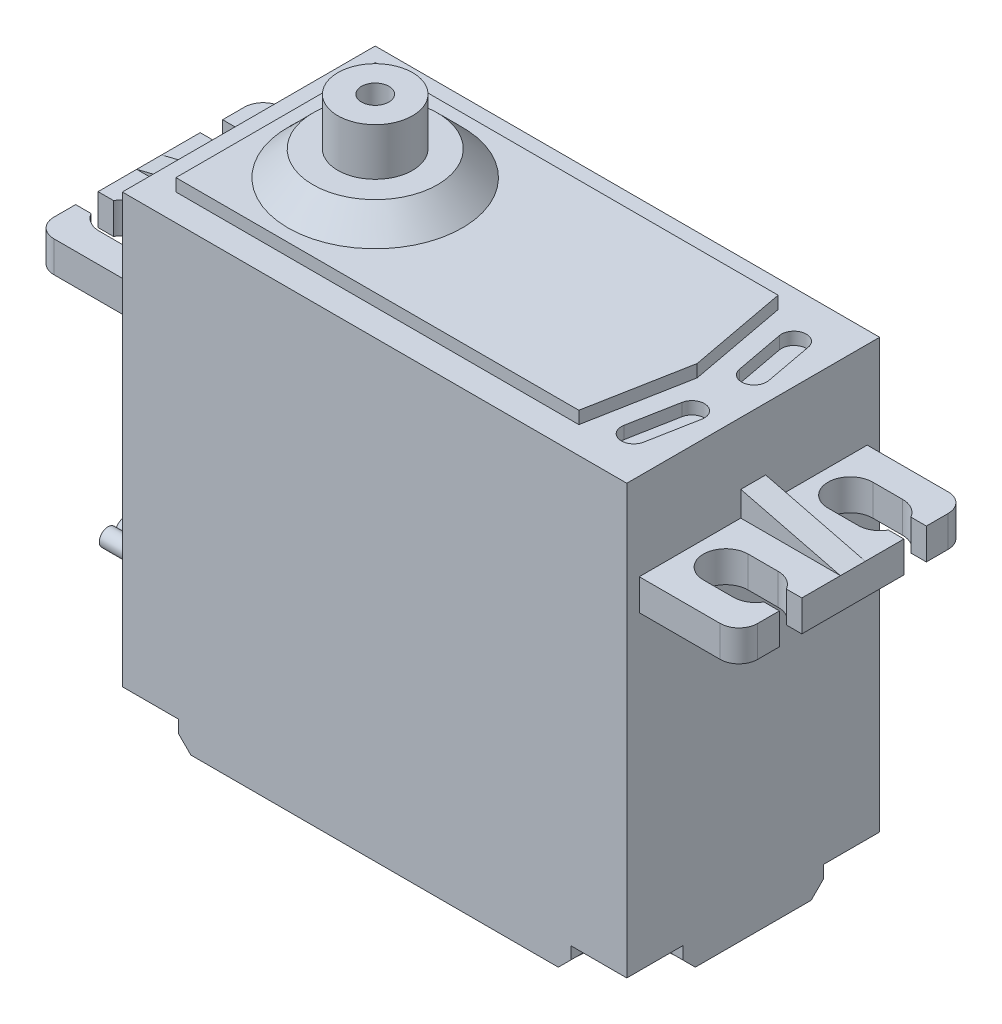
from build123d import *

# Parameters (mm, degrees)
SKETCH1_W                = 40.5
SKETCH1_H                = 20.3
BOSS_EXTRUDE1_DEPTH      = 37.4
SKETCH2_R                = 7
BOSS_EXTRUDE2_DEPTH      = 2
CHAMFER1_SIZE            = 2
SKETCH3_R                = 3
SKETCH3_R_2              = 1.1
BOSS_EXTRUDE3_DEPTH      = 3.8
SKETCH4_W                = 8
SKETCH4_H                = 18.3
BOSS_EXTRUDE4_DEPTH      = 2.5
CUT_EXTRUDE1_DEPTH       = 43.01719886
BOSS_EXTRUDE5_DEPTH      = 1
MIRROR3_COPY_1_DEPTH     = 43.01719886
FILLET2_R                = 1.5
SKETCH7_W                = 7.5
SKETCH7_H                = 4
BOSS_EXTRUDE6_DEPTH      = 5
BOSS_EXTRUDE7_DEPTH      = 5
DRAFT1_ANGLE             = 5
FILLET3_R                = 1.5
CUT_EXTRUDE2_DEPTH       = 2
CHAMFER2_SIZE            = 1
CHAMFER2_OF_MIRROR4_SIZE = 1
MIRROR5_START            = 18.75
MIRROR5_3_DEPTH          = 2.25
MIRROR5_START_2          = -11
MIRROR5_4_DEPTH          = 2.35
MIRROR5_START_3          = 8.65
MIRROR5_5_DEPTH          = 2.35
SKETCH10_W               = 40.5
SKETCH10_H               = 20.3
CUT_EXTRUDE3_DEPTH       = 1
CUT_EXTRUDE4_DEPTH       = 1


with BuildPart() as part:
    # Sketch1 → Boss-Extrude1 (new body)
    with BuildSketch(Plane(origin=(0, 0, 0), x_dir=(1, 0, 0), z_dir=(0, 1, 0))):
        Rectangle(SKETCH1_W, SKETCH1_H)
    extrude(amount=BOSS_EXTRUDE1_DEPTH)

    # Sketch2 → Boss-Extrude2 (add)
    with BuildSketch(Plane(origin=(0, 37.4, 0), x_dir=(1, 0, 0), z_dir=(0, 1, 0))):
        with Locations(Location((-10.1, 0, 0), (0, 0, 270))):
            Circle(SKETCH2_R)
    extrude(amount=BOSS_EXTRUDE2_DEPTH)

    # Chamfer1
    chamfer1_edges = [part.edges().sort_by_distance(p)[0] for p in [
        (-10.1, 39.4, -7),
    ]]
    chamfer(chamfer1_edges, length=CHAMFER1_SIZE - 0.0001)  # a hair under: the kernel refuses the full size

    # Sketch3 → Boss-Extrude3 (add)
    with BuildSketch(Plane(origin=(0, 39.4, 0), x_dir=(1, 0, 0), z_dir=(0, 1, 0))):
        with Locations(Location((-10.1, 0, 0), (0, 0, 90))):
            Circle(SKETCH3_R)
        with Locations(Location((-10.1, 0, 0), (0, 0, 90))):
            Circle(SKETCH3_R_2, mode=Mode.SUBTRACT)
    extrude(amount=BOSS_EXTRUDE3_DEPTH)

    # Sketch4 → Boss-Extrude4 (add)
    with BuildSketch(Plane(origin=(0, 29.4, 0), x_dir=(1, 0, 0), z_dir=(0, 1, 0))):
        with Locations((-24.25, 0)):
            Rectangle(SKETCH4_W, SKETCH4_H)
    boss_extrude4 = extrude(amount=-BOSS_EXTRUDE4_DEPTH)

    # Sketch5 → Cut-Extrude1 (cut, through all)
    with BuildSketch(Plane(origin=(0, 29.4, 0), x_dir=(1, 0, 0), z_dir=(0, 1, 0))):
        with BuildLine():
            Line((-25.45, -3.2), (-23.05, -3.2))
            ThreePointArc((-23.05, -3.2), (-21.25, -5), (-23.05, -6.8))
            Line((-23.05, -6.8), (-25.45, -6.8))
            ThreePointArc((-25.45, -6.8), (-26.35, -6.558845727), (-27.008845727, -5.9))
            Line((-27.008845727, -5.9), (-28.25, -5.9))
            Line((-28.25, -5.9), (-28.25, -4.1))
            Line((-28.25, -4.1), (-27.008845727, -4.1))
            ThreePointArc((-27.008845727, -4.1), (-26.35, -3.441154273), (-25.45, -3.2))
        make_face()
    cut_extrude1 = extrude(amount=-CUT_EXTRUDE1_DEPTH, mode=Mode.SUBTRACT)

    # Mirror2: Cut-Extrude1 across plane
    add(cut_extrude1.mirror(Plane.XY), mode=Mode.SUBTRACT)

    # Sketch6 → Boss-Extrude5 (add, symmetric)
    with BuildSketch(Plane.XY):
        Polygon((-28.25, 29.4), (-20.25, 29.4), (-20.25, 31.4), align=None)
    boss_extrude5 = extrude(amount=BOSS_EXTRUDE5_DEPTH, both=True)

    # Mirror3: Boss-Extrude4, Cut-Extrude1, Boss-Extrude5 across plane
    add(boss_extrude4.mirror(Plane(origin=(0, 0, 0), x_dir=(0, 0, 1), z_dir=(1, 0, 0))))
    add(cut_extrude1.mirror(Plane(origin=(0, 0, 0), x_dir=(0, 0, 1), z_dir=(1, 0, 0))), mode=Mode.SUBTRACT)
    add(boss_extrude5.mirror(Plane(origin=(0, 0, 0), x_dir=(0, 0, 1), z_dir=(1, 0, 0))))

    # Mirror3 copy 1 sketch → Mirror3 copy 1 (cut, through all)
    with BuildSketch(Plane(origin=(0, 29.4, 0), x_dir=(-1, 0, 0), z_dir=(0, 1, 0))):
        with BuildLine():
            Line((-25.45, -3.2), (-23.05, -3.2))
            ThreePointArc((-23.05, -3.2), (-21.25, -5), (-23.05, -6.8))
            Line((-23.05, -6.8), (-25.45, -6.8))
            ThreePointArc((-25.45, -6.8), (-26.35, -6.558845727), (-27.008845727, -5.9))
            Line((-27.008845727, -5.9), (-28.25, -5.9))
            Line((-28.25, -5.9), (-28.25, -4.1))
            Line((-28.25, -4.1), (-27.008845727, -4.1))
            ThreePointArc((-27.008845727, -4.1), (-26.35, -3.441154273), (-25.45, -3.2))
        make_face()
    extrude(amount=-MIRROR3_COPY_1_DEPTH, mode=Mode.SUBTRACT)

    # Fillet2
    fillet2_edges = [part.edges().sort_by_distance(p)[0] for p in [
        (28.25, 28.15, -9.15),
        (28.25, 28.15, 9.15),
        (-28.25, 28.15, 9.15),
        (-28.25, 28.15, -9.15),
    ]]
    fillet(fillet2_edges, radius=FILLET2_R)

    # Sketch7 → Boss-Extrude6 (add)
    with BuildSketch(Plane.ZY.offset(20.25)):
        with Locations((0, 3)):
            Rectangle(SKETCH7_W, SKETCH7_H)
    extrude(amount=BOSS_EXTRUDE6_DEPTH)

    # Sketch8 → Boss-Extrude7 (add)
    with BuildSketch(Plane.ZY.offset(25.25)):
        with BuildLine():
            ThreePointArc((-0.65, 3.259807621), (-2, 3), (-0.65, 2.740192379))
            ThreePointArc((-0.65, 2.740192379), (0, 2.3), (0.65, 2.740192379))
            ThreePointArc((0.65, 2.740192379), (2, 3), (0.65, 3.259807621))
            ThreePointArc((0.65, 3.259807621), (0, 3.7), (-0.65, 3.259807621))
        make_face()
    extrude(amount=BOSS_EXTRUDE7_DEPTH)

    # Draft1
    draft1_faces = [part.faces().sort_by_distance(p)[0] for p in [
        (-22.75, 1, 0),
        (-22.75, 3, -3.75),
        (-22.75, 3, 3.75),
        (-22.75, 5, 0),
    ]]
    draft(draft1_faces, Plane(origin=(-20.25, 37.4, -10.15), x_dir=(0, 0, -1), z_dir=(-1, 0, 0)), DRAFT1_ANGLE)

    # Fillet3
    fillet3_edges = [part.edges().sort_by_distance(p)[0] for p in [
        (-22.75, 4.781278341, -3.531278341),
        (-22.75, 1.218721659, -3.531278341),
        (-22.75, 1.218721659, 3.531278341),
        (-22.75, 4.781278341, 3.531278341),
    ]]
    fillet(fillet3_edges, radius=FILLET3_R)

    # Sketch9 → Cut-Extrude2 (cut)
    with BuildSketch(Plane.XZ):
        with BuildLine():
            Line((-20.25, 10.15), (-20.25, 5.65))
            Line((-20.25, 5.65), (-18.75, 5.65))
            ThreePointArc((-18.75, 5.65), (-16.628679656, 6.528679656), (-15.75, 8.65))
            Line((-15.75, 8.65), (-15.75, 10.15))
            Line((-15.75, 10.15), (-20.25, 10.15))
        make_face()
    cut_extrude2 = extrude(amount=-CUT_EXTRUDE2_DEPTH, mode=Mode.SUBTRACT)

    # Chamfer2
    chamfer2_edges = [part.edges().sort_by_distance(p)[0] for p in [
        (-19.5, 0, 5.65),
        (-16.628679656, 0, 6.528679656),
        (-15.75, 0, 9.4),
    ]]
    chamfer(chamfer2_edges, length=CHAMFER2_SIZE)

    # Mirror4: Cut-Extrude2 across plane
    add(cut_extrude2.mirror(Plane.XY), mode=Mode.SUBTRACT)

    # Chamfer2 of Mirror4
    chamfer2_of_mirror4_edges = [part.edges().sort_by_distance(p)[0] for p in [
        (-19.5, 0, -5.65),
        (-16.628679656, 0, -6.528679656),
        (-15.75, 0, -9.4),
    ]]
    chamfer(chamfer2_of_mirror4_edges, length=CHAMFER2_OF_MIRROR4_SIZE)

    # Mirror5: read off the stored shape, not the designer's step
    # Mirror5 outline → Mirror5 (revolve, cut)
    with BuildSketch(Plane(origin=(18.75, 0, -8.65), x_dir=(1, 0, 0), z_dir=(0, 0, 1))):
        Polygon((3, 1), (3, 2), (0, 2), (0, 0), (4, 0), align=None)
    revolve(axis=Axis((18.75, 0, -8.65), (0, 1, 0)), mode=Mode.SUBTRACT)

    # Mirror5 2 outline → Mirror5 2 (revolve, cut)
    with BuildSketch(Plane(origin=(18.75, 0, 8.65), x_dir=(1, 0, 0), z_dir=(0, 0, 1))):
        Polygon((3, 1), (3, 2), (0, 2), (0, 0), (4, 0), align=None)
    revolve(axis=Axis((18.75, 0, 8.65), (0, 1, 0)), mode=Mode.SUBTRACT)

    # Mirror5 3 outline → Mirror5 3 (cut)
    with BuildSketch(Plane.YZ.offset(MIRROR5_START)):
        Polygon((1, -5.65), (0, -4.65), (0, -10.15), (2, -10.15), (2, -5.65), align=None)
        Polygon((1, 5.65), (2, 5.65), (2, 10.15), (0, 10.15), (0, 4.65), align=None)
    extrude(amount=MIRROR5_3_DEPTH, mode=Mode.SUBTRACT)

    # Mirror5 4 outline → Mirror5 4 (cut)
    with BuildSketch(Plane.XY.offset(MIRROR5_START_2)):
        Polygon((15.75, 2), (15.75, 1), (14.75, 0), (20.25, 0), (20.25, 2), align=None)
    extrude(amount=MIRROR5_4_DEPTH, mode=Mode.SUBTRACT)

    # Mirror5 5 outline → Mirror5 5 (cut)
    with BuildSketch(Plane.XY.offset(MIRROR5_START_3)):
        Polygon((15.75, 2), (15.75, 1), (14.75, 0), (20.25, 0), (20.25, 2), align=None)
    extrude(amount=MIRROR5_5_DEPTH, mode=Mode.SUBTRACT)

    # Sketch10 → Cut-Extrude3 (cut)
    with BuildSketch(Plane(origin=(0, 37.4, 0), x_dir=(1, 0, 0), z_dir=(0, 1, 0))):
        Rectangle(SKETCH10_W, SKETCH10_H)
        Polygon((-18.1, -8), (14.25, -8), (15.75, 0), (14.25, 8), (-18.1, 8), align=None, mode=Mode.SUBTRACT)
    extrude(amount=-CUT_EXTRUDE3_DEPTH, mode=Mode.SUBTRACT)

    # Sketch11 → Cut-Extrude4 (cut)
    with BuildSketch(Plane(origin=(0, 36.4, 0), x_dir=(1, 0, 0), z_dir=(0, 1, 0))):
        with BuildLine():
            Line((16.842885351, 2.310688429), (16.10573121, 6.242177176))
            ThreePointArc((16.10573121, 6.242177176), (16.904314862, 7.409337898), (18.071475584, 6.610754247))
            Line((18.071475584, 6.610754247), (18.808629724, 2.679265499))
            ThreePointArc((18.808629724, 2.679265499), (18.010046072, 1.512104777), (16.842885351, 2.310688429))
        make_face()
    cut_extrude4 = extrude(amount=-CUT_EXTRUDE4_DEPTH, mode=Mode.SUBTRACT)

    # Mirror6: Cut-Extrude4 across plane
    add(cut_extrude4.mirror(Plane.XY), mode=Mode.SUBTRACT)


solid = part.part
